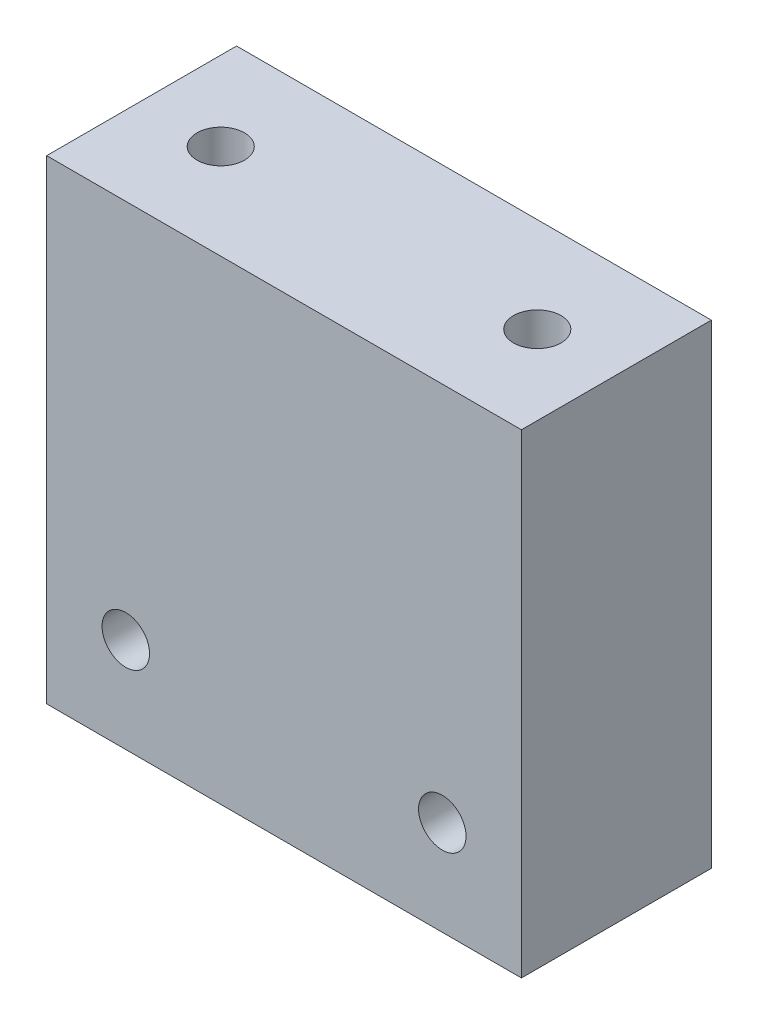
from build123d import *

# Parameters (mm, degrees)
SKETCH1_W           = 30
SKETCH1_H           = 30
BOSS_EXTRUDE1_DEPTH = 12
SKETCH2_R           = 1.5
CUT_EXTRUDE1_DEPTH  = 45.09081537
SKETCH3_R           = 1.5
CUT_EXTRUDE2_DEPTH  = 5


with BuildPart() as part:
    # Sketch1 → Boss-Extrude1 (new body)
    with BuildSketch(Plane.XY):
        with Locations((15, 15)):
            Rectangle(SKETCH1_W, SKETCH1_H)
    extrude(amount=BOSS_EXTRUDE1_DEPTH)

    # Sketch2 → Cut-Extrude1 (cut, through all)
    with BuildSketch(Plane.XY.offset(12)):
        with Locations((5, 6)):
            Circle(SKETCH2_R)
        with Locations((25, 6)):
            Circle(SKETCH2_R)
    extrude(amount=-CUT_EXTRUDE1_DEPTH, mode=Mode.SUBTRACT)

    # Sketch3 → Cut-Extrude2 (cut)
    with BuildSketch(Plane(origin=(0, 30, 0), x_dir=(1, 0, 0), z_dir=(0, 1, 0))):
        with Locations((5, -6)):
            Circle(SKETCH3_R)
        with Locations((25, -6)):
            Circle(SKETCH3_R)
    extrude(amount=-CUT_EXTRUDE2_DEPTH, mode=Mode.SUBTRACT)


solid = part.part
